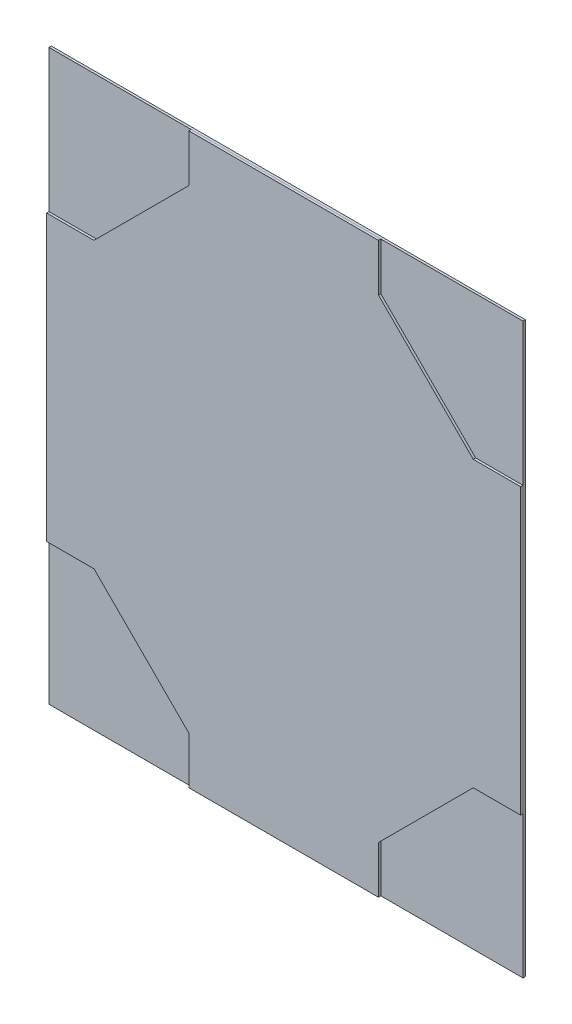
from build123d import *

# Parameters (mm, degrees)
SKETCH1_W           = 635
SKETCH1_H           = 762
BOSS_EXTRUDE1_DEPTH = 3.175
BOSS_EXTRUDE2_DEPTH = 3.175


with BuildPart() as part:
    # Sketch1 → Boss-Extrude1 (new body)
    with BuildSketch(Plane.XY):
        Rectangle(SKETCH1_W, SKETCH1_H)
    extrude(amount=BOSS_EXTRUDE1_DEPTH)


with BuildPart() as body_2:
    # Sketch3 → Boss-Extrude2 (new body)
    with BuildSketch(Plane.XY.offset(3.175)):
        Polygon((-127, 381), (127, 381), (127, 317.5), (254, 190.5), (317.5, 190.5), (317.5, -190.5), (254, -190.5), (127, -317.5), (127, -381), (-127, -381), (-127, -317.5), (-254, -190.5), (-317.5, -190.5), (-317.5, 190.5), (-254, 190.5), (-127, 317.5), align=None)
    extrude(amount=BOSS_EXTRUDE2_DEPTH)


solid = Compound([part.part, body_2.part])
